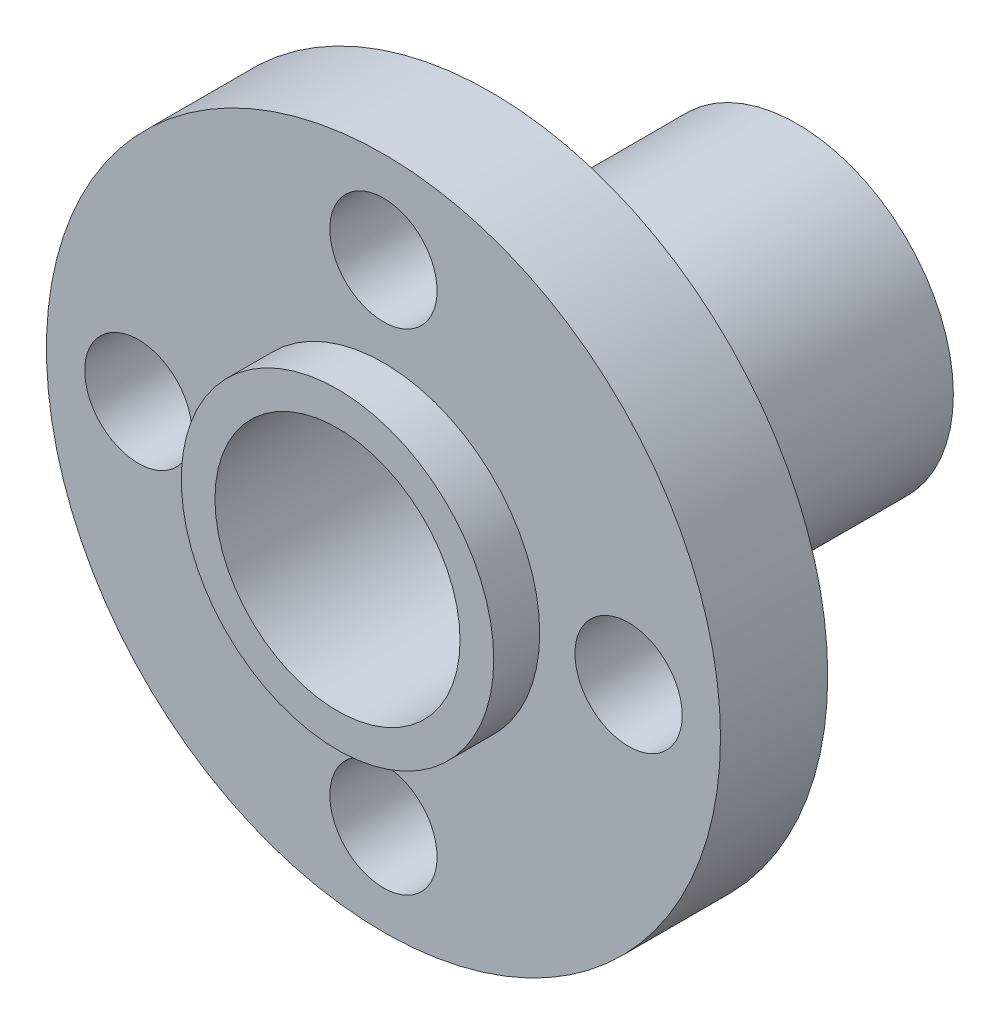
from build123d import *
from build123d.topology import SkipClean

# Parameters (mm, degrees)
SKETCH1_R           = 11
SKETCH1_R_2         = 1.75
SKETCH1_R_3         = 4
BOSS_EXTRUDE1_DEPTH = 3.5
BOSS_EXTRUDE2_START = 10
SKETCH2_R           = 5.1
SKETCH2_R_2         = 4
BOSS_EXTRUDE2_DEPTH = 10
SKETCH3_R           = 5.1
SKETCH3_R_2         = 4
BOSS_EXTRUDE3_DEPTH = 1.5


with BuildPart() as part:
    # Sketch1 → Boss-Extrude1 (new body)
    with BuildSketch(Plane.XY):
        Circle(SKETCH1_R)
        with Locations((0, 8)):
            Circle(SKETCH1_R_2, mode=Mode.SUBTRACT)
        with Locations((-8, 0)):
            Circle(SKETCH1_R_2, mode=Mode.SUBTRACT)
        with Locations((0, -8)):
            Circle(SKETCH1_R_2, mode=Mode.SUBTRACT)
        with Locations((8, 0)):
            Circle(SKETCH1_R_2, mode=Mode.SUBTRACT)
        Circle(SKETCH1_R_3, mode=Mode.SUBTRACT)
    extrude(amount=BOSS_EXTRUDE1_DEPTH)

    # Sketch2 → Boss-Extrude2 (add)
    with SkipClean():  # the faces are left unmerged after this step: merging them gives an invalid solid
        with BuildSketch(Plane(origin=(0, 0, 0), x_dir=(-1, 0, 0), z_dir=(0, 0, -1)).offset(BOSS_EXTRUDE2_START)):
            Circle(SKETCH2_R)
            Circle(SKETCH2_R_2, mode=Mode.SUBTRACT)
        extrude(amount=-BOSS_EXTRUDE2_DEPTH)

    # Sketch3 → Boss-Extrude3 (add)
    with BuildSketch(Plane.XY.offset(3.5)):
        Circle(SKETCH3_R)
        Circle(SKETCH3_R_2, mode=Mode.SUBTRACT)
    extrude(amount=BOSS_EXTRUDE3_DEPTH)


solid = part.part
